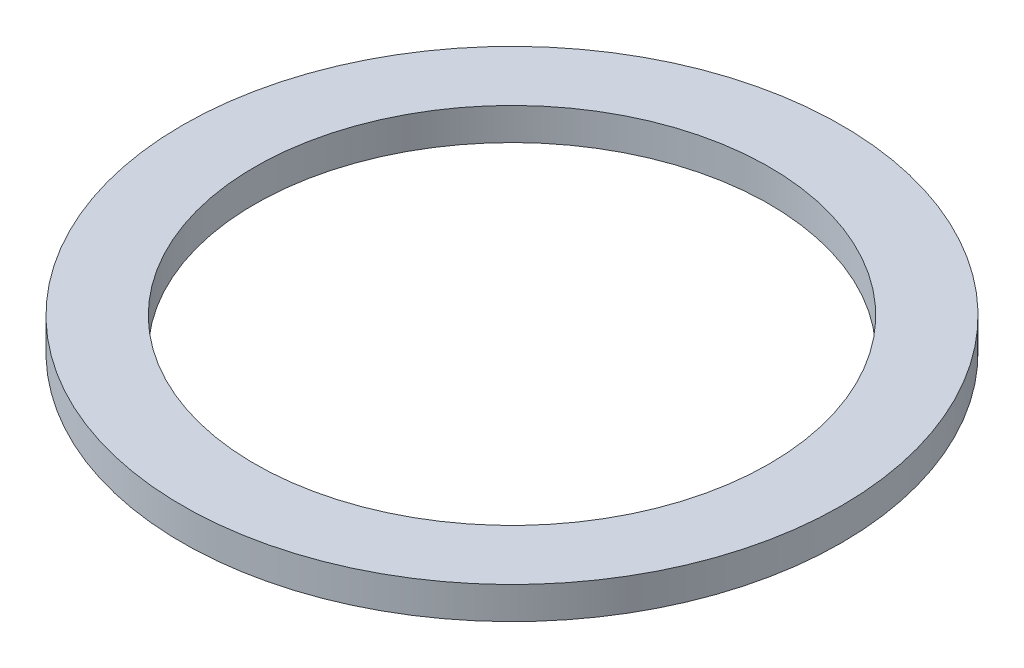
from build123d import *

# Parameters (mm, degrees)
SKETCH1_W = 28.575
SKETCH1_H = 12.7


with BuildPart() as part:
    # Sketch1 → Revolve1 (revolve)
    with BuildSketch(Plane.XY):
        with Locations((115.8875, 145.287866462)):
            Rectangle(SKETCH1_W, SKETCH1_H)
    revolve(axis=Axis((1e-09, -200000, 0), (0, 1, 0)))


solid = part.part
